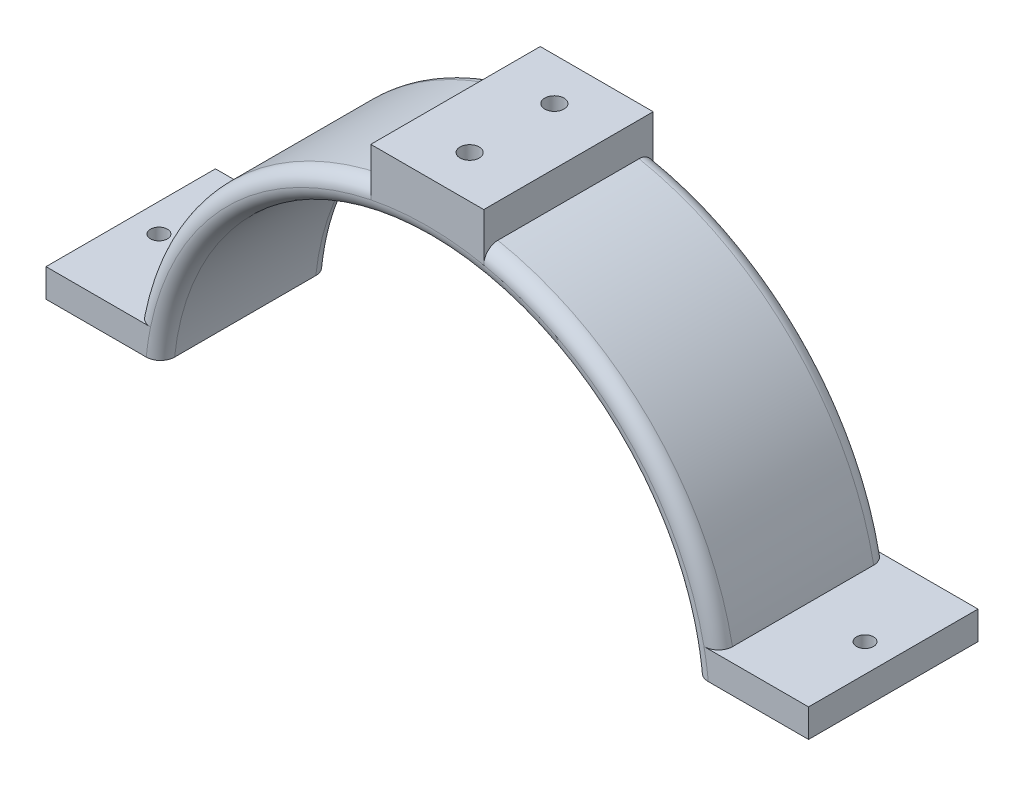
from build123d import *

# Parameters (mm, degrees)
BOSS_EXTRUDE1_DEPTH                             = 30
FILLET1_R                                       = 2.5
SKETCH6_R                                       = 3.75
CUT_EXTRUDE1_DEPTH                              = 47.5
CSK_FOR_M3_FLAT_HEAD_MACHINE_SCREW1_D           = 3.4
CSK_FOR_M3_FLAT_HEAD_MACHINE_SCREW1_CSINK_D     = 6.3
CSK_FOR_M3_FLAT_HEAD_MACHINE_SCREW1_CSINK_ANGLE = 90
F_3_0MM_DOWEL_HOLE1_D                           = 3


with BuildPart() as part:
    # Sketch1 → Boss-Extrude1 (new body)
    with BuildSketch(Plane.XY):
        with BuildLine():
            Line((47.236109069, 5), (67.5, 5))
            Line((67.5, 5), (67.5, 10))
            Line((67.5, 10), (51.53882032, 10))
            ThreePointArc((51.53882032, 10), (37.123106012, 37.123106012), (10, 51.53882032))
            Line((10, 51.53882032), (10, 57.5))
            Line((10, 57.5), (-10, 57.5))
            Line((-10, 57.5), (-10, 51.53882032))
            ThreePointArc((-10, 51.53882032), (-37.123106012, 37.123106012), (-51.53882032, 10))
            Line((-51.53882032, 10), (-67.5, 10))
            Line((-67.5, 10), (-67.5, 5))
            Line((-67.5, 5), (-47.236109069, 5))
            ThreePointArc((-47.236109069, 5), (0, 47.5), (47.236109069, 5))
        make_face()
    extrude(amount=BOSS_EXTRUDE1_DEPTH)

    # Fillet1
    fillet1_edges = [part.edges().sort_by_distance(p)[0] for p in [
        (37.123106012, 37.123106012, 0),
        (0, 47.5, 0),
        (-37.123106012, 37.123106012, 0),
        (0, 47.5, 30),
        (37.123106012, 37.123106012, 30),
        (-37.123106012, 37.123106012, 30),
    ]]
    fillet(fillet1_edges, radius=FILLET1_R - 0.0001)  # a hair under: the kernel refuses the full size

    # Sketch6 → Cut-Extrude1 (cut)
    with BuildSketch(Plane.XZ.offset(-5)):
        with Locations(Location((0, 22.5, 0), (0, 0, 270))):
            Circle(SKETCH6_R)
        with Locations(Location((0, 7.5, 0), (0, 0, 270))):
            Circle(SKETCH6_R)
    extrude(amount=-CUT_EXTRUDE1_DEPTH, mode=Mode.SUBTRACT)

    # CSK for M3 Flat Head Machine Screw1 (through all)
    with Locations(Plane(origin=(0, 52.5, 0), x_dir=(-1, 0, 0), z_dir=(0, -1, 0))):
        with Locations((0, -22.5), (0, -7.5)):
            CounterSinkHole(CSK_FOR_M3_FLAT_HEAD_MACHINE_SCREW1_D / 2, CSK_FOR_M3_FLAT_HEAD_MACHINE_SCREW1_CSINK_D / 2, counter_sink_angle=CSK_FOR_M3_FLAT_HEAD_MACHINE_SCREW1_CSINK_ANGLE)

    # Ø3.0mm Dowel Hole1 (through all)
    with Locations(Plane(origin=(0, 10, 0), x_dir=(1, 0, 0), z_dir=(0, 1, 0))):
        with Locations((-62.5, -15), (62.5, -15)):
            Hole(F_3_0MM_DOWEL_HOLE1_D / 2)


solid = part.part
